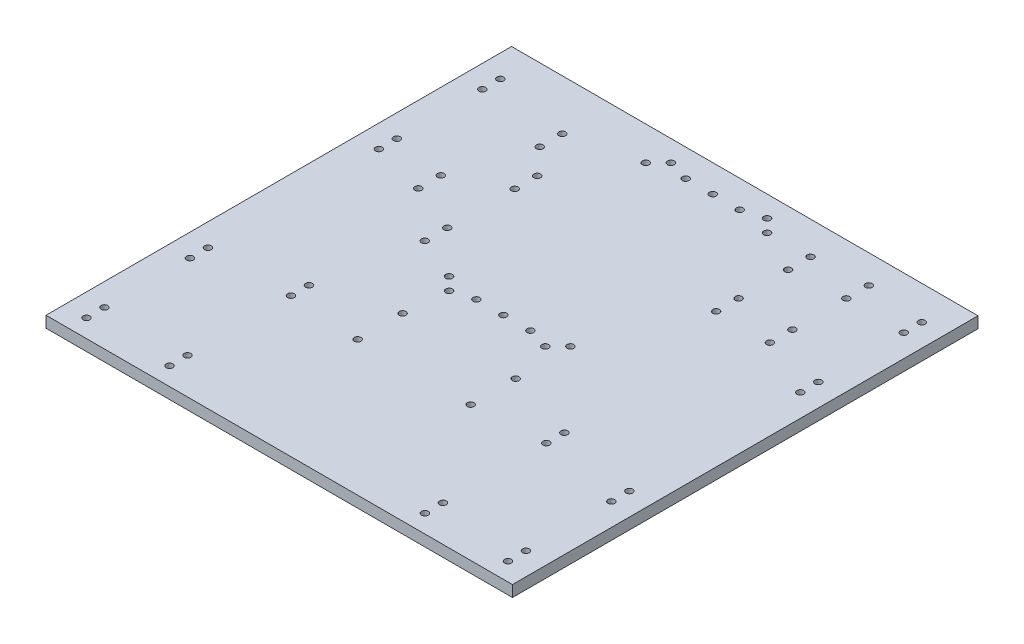
from build123d import *

# Parameters (mm, degrees)
SKETCH1_W              = 263.40054
SKETCH1_H              = 254
BOSS_EXTRUDE1_DEPTH    = 6.35
F_6_CLEARANCE_HOLE1_D  = 3.7973
F_6_CLEARANCE_HOLE2_D  = 3.7973
F_6_CLEARANCE_HOLE3_D  = 3.7973
F_6_CLEARANCE_HOLE4_D  = 3.7973
MIRROR2_COPY_1_D       = 3.7973
F_6_CLEARANCE_HOLE5_D  = 3.7973
F_6_CLEARANCE_HOLE6_D  = 3.7973
F_6_CLEARANCE_HOLE8_D  = 3.7973
F_6_CLEARANCE_HOLE9_D  = 3.7973
F_6_CLEARANCE_HOLE10_D = 3.7973
F_6_CLEARANCE_HOLE7_D  = 3.7973
SKETCH23_W             = 263.40054
SKETCH23_H             = 8.89
BOSS_EXTRUDE2_DEPTH    = 6.35


with BuildPart() as part:
    # Sketch1 → Boss-Extrude1 (new body)
    with BuildSketch(Plane(origin=(0, 0, 0), x_dir=(1, 0, 0), z_dir=(0, 1, 0))):
        Rectangle(SKETCH1_W, SKETCH1_H)
    extrude(amount=BOSS_EXTRUDE1_DEPTH)

    # #6 Clearance Hole1 (through all)
    with Locations(Plane(origin=(0, 6.35, 0), x_dir=(1, 0, 0), z_dir=(0, 1, 0))):
        with Locations((119.00027, 116.84), (119.00027, 106.68), (119.00027, 58.42), (119.00027, 48.26)):
            f_6_clearance_hole1 = Hole(F_6_CLEARANCE_HOLE1_D / 2)

    # Mirror1: #6 Clearance Hole1 across plane
    add(f_6_clearance_hole1.mirror(Plane(origin=(0, 0, 0), x_dir=(1, 0, 0), z_dir=(0, 0, -1))), mode=Mode.SUBTRACT)

    # #6 Clearance Hole2 (through all)
    with Locations(Plane(origin=(0, 6.35, 0), x_dir=(1, 0, 0), z_dir=(0, 1, 0))):
        with Locations((86.07933, 119.89562), (86.07933, 107.19562), (86.07933, 76.71562), (86.07933, 64.01562)):
            Hole(F_6_CLEARANCE_HOLE2_D / 2)

    # #6 Clearance Hole3 (through all)
    with Locations(Plane(origin=(0, 6.35, 0), x_dir=(1, 0, 0), z_dir=(0, 1, 0))):
        with Locations((55.59933, 117.44198), (55.59933, 104.74198), (55.59933, 76.80198), (55.59933, 64.10198)):
            Hole(F_6_CLEARANCE_HOLE3_D / 2)

    # #6 Clearance Hole4 (through all)
    with Locations(Plane(origin=(0, 6.35, 0), x_dir=(1, 0, 0), z_dir=(0, 1, 0))):
        with Locations((72.11187, -38.1), (72.11187, -48.26), (72.11187, -106.68), (72.11187, -116.84)):
            f_6_clearance_hole4 = Hole(F_6_CLEARANCE_HOLE4_D / 2)

    # Mirror2: #6 Clearance Hole1, #6 Clearance Hole4 across plane
    add(f_6_clearance_hole1.mirror(Plane.ZY), mode=Mode.SUBTRACT)
    add(f_6_clearance_hole4.mirror(Plane.ZY), mode=Mode.SUBTRACT)

    # Mirror2 copy 1 (through all)
    with Locations(Plane(origin=(0, 6.35, 0), x_dir=(-1, 0, 0), z_dir=(0, 1, 0))):
        with Locations((119.00027, 116.84), (119.00027, 106.68), (119.00027, 58.42), (119.00027, 48.26)):
            Hole(MIRROR2_COPY_1_D / 2)

    # #6 Clearance Hole5 (through all)
    with Locations(Plane(origin=(0, 6.35, 0), x_dir=(1, 0, 0), z_dir=(0, 1, 0))):
        with Locations((-74.65187, 107.47502), (-74.65187, 94.77502), (-88.62187, 52.862550612), (-88.62187, 40.162550612)):
            Hole(F_6_CLEARANCE_HOLE5_D / 2)

    # #6 Clearance Hole6 (through all)
    with Locations(Plane(origin=(0, 6.35, 0), x_dir=(1, 0, 0), z_dir=(0, 1, 0))):
        with Locations((-61.15685, 79.84998), (-61.15685, 67.14998), (-61.15685, 29.04998), (-61.15685, 16.34998)):
            Hole(F_6_CLEARANCE_HOLE6_D / 2)

    # #6 Clearance Hole8 (through all)
    with Locations(Plane(origin=(0, 6.35, 0), x_dir=(1, 0, 0), z_dir=(0, 1, 0))):
        with Locations((-36.91763, 5.81914), (-29.80563, -1.29286)):
            Hole(F_6_CLEARANCE_HOLE8_D / 2)

    # #6 Clearance Hole9 (through all)
    with Locations(Plane(origin=(0, 6.35, 0), x_dir=(1, 0, 0), z_dir=(0, 1, 0))):
        with Locations((-29.80563, 123.97232), (-36.91763, 116.86032)):
            Hole(F_6_CLEARANCE_HOLE9_D / 2)

    # #6 Clearance Hole10 (through all)
    with Locations(Plane(origin=(0, 6.35, 0), x_dir=(1, 0, 0), z_dir=(0, 1, 0))):
        with Locations((-17.89049, 2.26314), (-2.65049, 2.26314), (12.58951, 2.26314), (-17.890285947, 120.41632), (-2.65049, 120.495183862), (12.589305947, 120.41632), (24.50465, 123.97232), (31.61665, 116.86032), (24.50465, -1.29286), (31.61665, 5.81914)):
            Hole(F_6_CLEARANCE_HOLE10_D / 2)

    # #6 Clearance Hole7 (through all)
    with Locations(Plane(origin=(0, 6.35, 0), x_dir=(1, 0, 0), z_dir=(0, 1, 0))):
        with Locations((-31.92145, -25.4), (-31.92145, -50.8), (31.92145, -50.8), (31.92145, -25.4)):
            Hole(F_6_CLEARANCE_HOLE7_D / 2)

    # Sketch23 → Boss-Extrude2 (add)
    with BuildSketch(Plane(origin=(0, 6.35, 0), x_dir=(1, 0, 0), z_dir=(0, 1, 0))):
        with Locations((0, 131.445)):
            Rectangle(SKETCH23_W, SKETCH23_H)
    extrude(amount=-BOSS_EXTRUDE2_DEPTH)


solid = part.part
